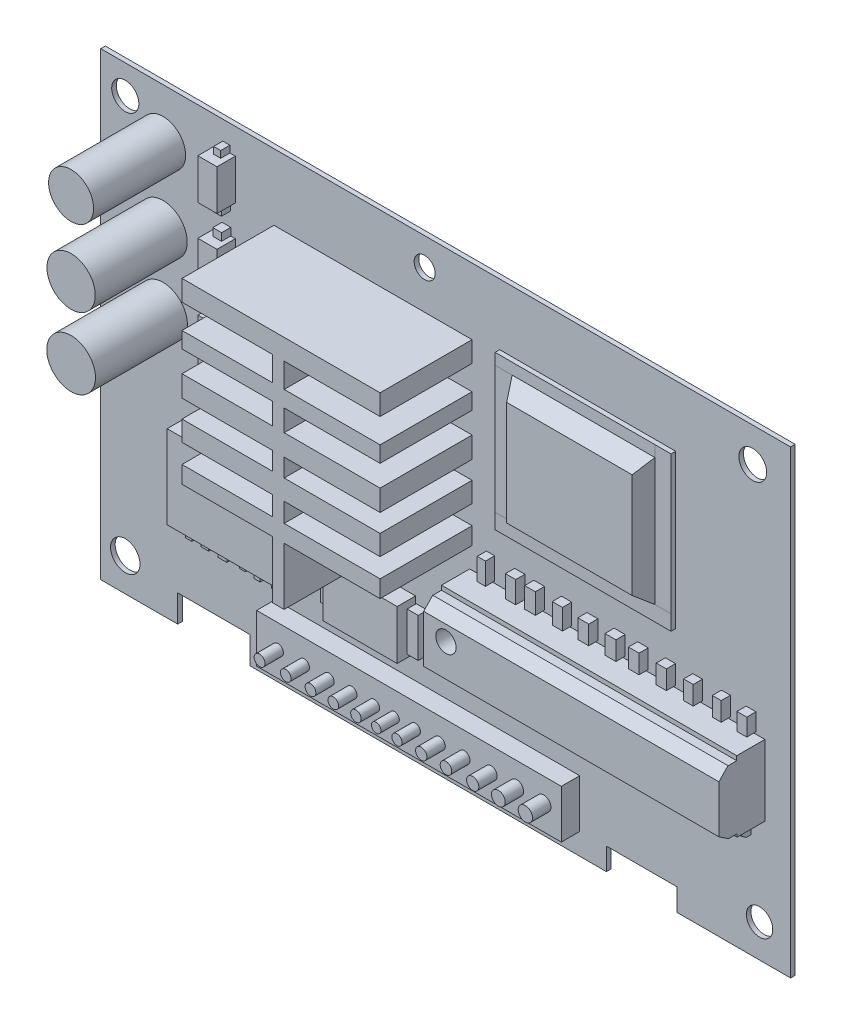
from build123d import *

# Parameters (mm, degrees)
SKETCH1_W            = 150
SKETCH1_H            = 100
BASE_FLANGE1_DEPTH   = 1
BOSS_EXTRUDE1_DEPTH  = 20
SKETCH7_W            = 38.251618342
SKETCH7_H            = 33.405476622
BOSS_EXTRUDE2_DEPTH  = 1
SKETCH20_R           = 4.893913718
SKETCH20_R_2         = 5.251573259
SKETCH20_R_3         = 5.291818848
BOSS_EXTRUDE6_DEPTH  = 20
SKETCH24_W           = 64.192317237
SKETCH24_H           = 15.400590588
BOSS_EXTRUDE8_DEPTH  = 10
CUT_EXTRUDE30_DEPTH  = 155.125892119
CUT_EXTRUDE31_DEPTH  = 70
SKETCH28_W           = 1.829521506
SKETCH28_H           = 1.981017468
CUT_EXTRUDE33_DEPTH  = 155.125892119
SKETCH29_W           = 1.913952811
SKETCH29_H           = 1.907943991
CUT_EXTRUDE34_DEPTH  = 70
SKETCH30_R           = 2.208258319
CUT_EXTRUDE35_DEPTH  = 4
SKETCH31_W           = 15.773922064
SKETCH31_H           = 7.980883473
CUT_EXTRUDE36_DEPTH  = 4
SKETCH32_W           = 15.316742759
SKETCH32_H           = 7.752912661
CUT_EXTRUDE37_DEPTH  = 4
SKETCH33_R           = 3.026227229
CUT_EXTRUDE38_DEPTH  = 4
SKETCH34_R           = 2.94966091
SKETCH34_R_2         = 3.19837787
SKETCH34_R_3         = 2.871285426
CUT_EXTRUDE39_DEPTH  = 4
SKETCH35_W           = 25.995297727
SKETCH35_H           = 18.101056575
BOSS_EXTRUDE9_DEPTH  = 4
SKETCH36_W           = 66.247990623
SKETCH36_H           = 10.503055181
BOSS_EXTRUDE10_DEPTH = 4
SKETCH37_R           = 1.181265196
SKETCH37_R_2         = 1.148680325
SKETCH37_R_3         = 1.160826502
SKETCH37_R_4         = 1.147015866
SKETCH37_R_5         = 1.033782863
SKETCH37_R_6         = 1.118734734
SKETCH37_R_7         = 1.234131395
SKETCH37_R_8         = 1.248812987
SKETCH37_R_9         = 1.327543916
SKETCH37_R_10        = 1.495383113
SKETCH37_R_11        = 1.557211208
BOSS_EXTRUDE11_DEPTH = 4
SKETCH38_R           = 2.284411124
CUT_EXTRUDE40_DEPTH  = 4
SKETCH41_W           = 1.375715726
SKETCH41_H           = 2.451416596
BOSS_EXTRUDE12_DEPTH = 2
SKETCH42_W           = 1.626401118
SKETCH42_H           = 2.461788857
BOSS_EXTRUDE13_DEPTH = 2
SKETCH43_W           = 1.958242371
SKETCH43_H           = 2.595832426
BOSS_EXTRUDE14_DEPTH = 2
SKETCH44_W           = 1.307161781
SKETCH44_H           = 3.440066665
BOSS_EXTRUDE15_DEPTH = 2
SKETCH45_W           = 1.379680109
SKETCH45_H           = 3.07138269
BOSS_EXTRUDE16_DEPTH = 2
SKETCH46_W           = 1.229332724
SKETCH46_H           = 3.115343909
BOSS_EXTRUDE17_DEPTH = 2
SKETCH47_W           = 1.427413705
SKETCH47_H           = 2.291843062
BOSS_EXTRUDE18_DEPTH = 2
SKETCH48_W           = 1.293247009
SKETCH48_H           = 2.149750627
BOSS_EXTRUDE19_DEPTH = 2
SKETCH49_W           = 1.181554162
SKETCH49_H           = 2.147356577
BOSS_EXTRUDE20_DEPTH = 2
SKETCH50_W           = 1.044464477
SKETCH50_H           = 2.065160328
BOSS_EXTRUDE21_DEPTH = 2
SKETCH51_W           = 1.029224977
SKETCH51_H           = 2.03555594
BOSS_EXTRUDE22_DEPTH = 2
SKETCH52_W           = 1.229200506
SKETCH52_H           = 1.921496808
BOSS_EXTRUDE24_DEPTH = 2
SKETCH53_W           = 1.112480255
SKETCH53_H           = 1.939294632
BOSS_EXTRUDE25_DEPTH = 2
SKETCH54_W           = 1.460651109
SKETCH54_H           = 1.9628929
BOSS_EXTRUDE26_DEPTH = 2
SKETCH55_W           = 2.862023797
SKETCH55_H           = 4.090480276
BOSS_EXTRUDE27_DEPTH = 2
SKETCH56_W           = 2.013853896
SKETCH56_H           = 4.191456529
SKETCH56_W_2         = 2.414065377
SKETCH56_W_3         = 2.03515958
SKETCH56_W_4         = 2.075413009
SKETCH56_W_5         = 2.49735471
SKETCH56_W_6         = 2.201159214
SKETCH56_H_2         = 4.020421204
SKETCH56_W_7         = 2.258671053
SKETCH56_W_8         = 2.935957611
SKETCH56_W_9         = 2.233644039
SKETCH56_W_10        = 2.248145216
BOSS_EXTRUDE28_DEPTH = 2
SKETCH57_W           = 2.145937785
SKETCH57_H           = 3.766112071
SKETCH57_W_2         = 1.928839135
SKETCH57_H_2         = 4.09164846
SKETCH57_W_3         = 2.091540081
SKETCH57_W_4         = 2.21160144
SKETCH57_W_5         = 2.308978198
SKETCH57_W_6         = 2.389169442
SKETCH57_W_7         = 2.368555189
SKETCH57_W_8         = 2.225421976
SKETCH57_H_3         = 4.453812364
SKETCH57_W_9         = 2.327276879
SKETCH57_W_10        = 2.233921941
SKETCH57_H_4         = 4.761879491
SKETCH57_W_11        = 1.792325782
SKETCH57_H_5         = 4.770248678
BOSS_EXTRUDE29_DEPTH = 2
SKETCH58_W           = 3.061349205
SKETCH58_H           = 1.907791472
SKETCH58_W_2         = 1.986025538
SKETCH58_H_2         = 2.155402711
SKETCH58_W_3         = 2.334649661
SKETCH58_W_4         = 2.149597386
SKETCH58_W_5         = 2.057874793
SKETCH58_W_6         = 2.49493272
SKETCH58_W_7         = 2.221617764
SKETCH58_H_3         = 1.916423675
SKETCH58_W_8         = 2.234745779
SKETCH58_H_4         = 2.236082286
SKETCH58_W_9         = 2.968185876
SKETCH58_H_5         = 2.280175952
SKETCH58_W_10        = 2.22983103
SKETCH58_W_11        = 2.240524801
BOSS_EXTRUDE30_DEPTH = 2
CUT_EXTRUDE42_DEPTH  = 70
CUT_EXTRUDE43_DEPTH  = 70
SKETCH62_W           = 16.149656918
SKETCH62_H           = 10.730261251
BOSS_EXTRUDE31_DEPTH = 4
SKETCH63_W           = 4.162884384
SKETCH63_H           = 8.812013171
SKETCH63_H_2         = 9.491073275
SKETCH63_H_3         = 9.653694527
BOSS_EXTRUDE32_DEPTH = 4
SKETCH64_W           = 1.82396348
SKETCH64_H           = 2.286507606
SKETCH64_W_2         = 1.584314373
SKETCH64_H_2         = 1.452145851
SKETCH64_W_3         = 1.542977073
SKETCH64_H_3         = 1.110525837
SKETCH64_W_4         = 1.911962543
SKETCH64_H_4         = 1.637025818
SKETCH64_W_5         = 1.724683831
SKETCH64_H_5         = 1.418797602
SKETCH64_W_6         = 1.547170171
SKETCH64_H_6         = 1.462342792
BOSS_EXTRUDE33_DEPTH = 2
SKETCH65_W           = 2.41426032
SKETCH65_H           = 8.495336877
SKETCH65_W_2         = 2.52605134
SKETCH65_H_2         = 8.055999216
BOSS_EXTRUDE34_DEPTH = 2
SKETCH8_W            = 30.996510459
SKETCH8_H            = 27.675141165
BOSS_EXTRUDE36_DEPTH = 3
CUT_EXTRUDE45_DEPTH  = 40
CUT_EXTRUDE46_DEPTH  = 40
CUT_EXTRUDE48_DEPTH  = 40
CUT_EXTRUDE50_DEPTH  = 40
SCALE1_SCALE         = 0.3


# Sheet-metal steps are written as plain solids
with BuildPart() as part:
    # Sketch1 → Base-Flange1 (new body)
    with BuildSketch(Plane.XY):
        Rectangle(SKETCH1_W, SKETCH1_H)
    extrude(amount=-BASE_FLANGE1_DEPTH)

    # Sketch6 → Boss-Extrude1 (add)
    with BuildSketch(Plane.XY):
        Polygon((-17.647750579, 31.094193667), (-17.647750579, 25.768885259), (-37.3337456, 25.768885259), (-37.3337456, 22.28272734), (-17.647750579, 22.28272734), (-17.647750579, 17.622101617), (-37.3337456, 17.622101617), (-37.3337456, 13.026910723), (-17.647750579, 13.026910723), (-17.647750579, 9.091734312), (-37.3337456, 9.091734312), (-37.3337456, 4.705010118), (-17.647750579, 4.705010118), (-17.647750579, 0.536354704), (-37.3337456, 0.536354704), (-37.3337456, -3.191619653), (-17.647750579, -3.191619653), (-17.647750579, -15.655678223), (-15.115535007, -15.655678223), (-15.115535007, -3.191619653), (5.742253828, -3.191619653), (5.742253828, 0.536354704), (-15.115535007, 0.536354704), (-15.115535007, 4.705010118), (5.742253828, 4.705010118), (5.742253828, 9.091734312), (-15.115535007, 9.091734312), (-15.115535007, 13.026910723), (5.742253828, 13.026910723), (5.742253828, 17.622101617), (-15.115535007, 17.622101617), (-15.115535007, 22.28272734), (5.742253828, 22.28272734), (5.742253828, 25.768885259), (-15.115535007, 25.768885259), (-15.115535007, 31.094193667), (5.742253828, 31.094193667), (5.742253828, 35.571913058), (-37.3337456, 35.571913058), (-37.3337456, 31.094193667), align=None)
    extrude(amount=BOSS_EXTRUDE1_DEPTH)

    # Sketch7 → Boss-Extrude2 (add)
    with BuildSketch(Plane.XY):
        with Locations((30.876301757, 19.988298592)):
            Rectangle(SKETCH7_W, SKETCH7_H)
    extrude(amount=BOSS_EXTRUDE2_DEPTH)

    # Sketch20 → Boss-Extrude6 (add)
    with BuildSketch(Plane.XY):
        with Locations((-61.445747498, 39.123272928)):
            Circle(SKETCH20_R)
        with Locations((-61.445747498, 22.944365114)):
            Circle(SKETCH20_R_2)
        with Locations((-61.445747498, 7.478393427)):
            Circle(SKETCH20_R_3)
    extrude(amount=BOSS_EXTRUDE6_DEPTH)

    # Sketch24 → Boss-Extrude8 (add)
    with BuildSketch(Plane.XY):
        with Locations((37.315719775, -15.564442532)):
            Rectangle(SKETCH24_W, SKETCH24_H)
    extrude(amount=BOSS_EXTRUDE8_DEPTH)

    # Sketch25 → Cut-Extrude30 (cut, through all)
    with BuildSketch(Plane(origin=(69.411878394, 0, 0), x_dir=(0, 0, -1), z_dir=(1, 0, 0))):
        Polygon((-6.95948185, -23.264737826), (-10, -21.210215597), (-10.383799283, -21.210215597), (-13.173179255, -25.338260702), align=None)
    extrude(amount=-CUT_EXTRUDE30_DEPTH, mode=Mode.SUBTRACT)

    # Sketch26 → Cut-Extrude31 (cut)
    with BuildSketch(Plane(origin=(69.411878394, 0, 0), x_dir=(0, 0, -1), z_dir=(1, 0, 0))):
        Polygon((-7.157587152, -7.864147238), (-10, -10.846715803), (-12.149574274, -7.378868006), align=None)
    extrude(amount=-CUT_EXTRUDE31_DEPTH, mode=Mode.SUBTRACT)

    # Sketch28 → Cut-Extrude33 (cut, through all)
    with BuildSketch(Plane(origin=(69.411878394, 0, 0), x_dir=(0, 0, -1), z_dir=(1, 0, 0))):
        with Locations((-6.95948185, -23.596243063)):
            Rectangle(SKETCH28_W, SKETCH28_H)
    extrude(amount=-CUT_EXTRUDE33_DEPTH, mode=Mode.SUBTRACT)

    # Sketch29 → Cut-Extrude34 (cut)
    with BuildSketch(Plane(origin=(69.411878394, 0, 0), x_dir=(0, 0, -1), z_dir=(1, 0, 0))):
        with Locations((-7.07856122, -7.864147238)):
            Rectangle(SKETCH29_W, SKETCH29_H)
    extrude(amount=-CUT_EXTRUDE34_DEPTH, mode=Mode.SUBTRACT)

    # Sketch30 → Cut-Extrude35 (cut)
    with BuildSketch(Plane.XY.offset(10)):
        with Locations((10.059798535, -14.15654171)):
            Circle(SKETCH30_R)
    extrude(amount=-CUT_EXTRUDE35_DEPTH, mode=Mode.SUBTRACT)

    # Sketch31 → Cut-Extrude36 (cut)
    with BuildSketch(Plane.XY):
        with Locations((-50.382765947, -48.096382801)):
            Rectangle(SKETCH31_W, SKETCH31_H)
    extrude(amount=-CUT_EXTRUDE36_DEPTH, mode=Mode.SUBTRACT)

    # Sketch32 → Cut-Extrude37 (cut)
    with BuildSketch(Plane.XY):
        with Locations((42.623404519, -49.055562996)):
            Rectangle(SKETCH32_W, SKETCH32_H)
    extrude(amount=-CUT_EXTRUDE37_DEPTH, mode=Mode.SUBTRACT)

    # Sketch33 → Cut-Extrude38 (cut)
    with BuildSketch(Plane.XY):
        with Locations((66.770748421, 42.592540068)):
            Circle(SKETCH33_R)
    extrude(amount=-CUT_EXTRUDE38_DEPTH, mode=Mode.SUBTRACT)

    # Sketch34 → Cut-Extrude39 (cut)
    with BuildSketch(Plane.XY):
        with Locations((-69.666143344, 43.767302707)):
            Circle(SKETCH34_R)
        with Locations((-69.666143344, -42.810509177)):
            Circle(SKETCH34_R_2)
        with Locations((68.245145494, -42.810509177)):
            Circle(SKETCH34_R_3)
    extrude(amount=-CUT_EXTRUDE39_DEPTH, mode=Mode.SUBTRACT)

    # Sketch35 → Boss-Extrude9 (add)
    with BuildSketch(Plane.XY):
        with Locations((-43.558798458, -19.388431916)):
            Rectangle(SKETCH35_W, SKETCH35_H)
    extrude(amount=BOSS_EXTRUDE9_DEPTH)

    # Sketch36 → Boss-Extrude10 (add)
    with BuildSketch(Plane.XY):
        with Locations((-3.980345024, -40.083616171)):
            Rectangle(SKETCH36_W, SKETCH36_H)
    extrude(amount=BOSS_EXTRUDE10_DEPTH)

    # Sketch37 → Boss-Extrude11 (add)
    with BuildSketch(Plane.XY.offset(4)):
        with Locations((-32.461773453, -39.922141762)):
            Circle(SKETCH37_R)
        with Locations((-26.768920114, -39.922141762)):
            Circle(SKETCH37_R_2)
        with Locations((-21.391562505, -39.922141762)):
            Circle(SKETCH37_R_3)
        with Locations((-16.432461651, -39.922141762)):
            Circle(SKETCH37_R_4)
        with Locations((-11.514578285, -39.922141762)):
            Circle(SKETCH37_R_4)
        with Locations((-7.111969395, -39.922141762)):
            Circle(SKETCH37_R_5)
        with Locations((-2.592262692, -39.922141762)):
            Circle(SKETCH37_R_6)
        with Locations((2.686057552, -39.922141762)):
            Circle(SKETCH37_R_7)
        with Locations((8.058652609, -39.922141762)):
            Circle(SKETCH37_R_8)
        with Locations((13.87803858, -39.922141762)):
            Circle(SKETCH37_R_9)
        with Locations((19.454436288, -39.922141762)):
            Circle(SKETCH37_R_10)
        with Locations((25.32464073, -39.922141762)):
            Circle(SKETCH37_R_11)
    extrude(amount=BOSS_EXTRUDE11_DEPTH)

    # Sketch38 → Cut-Extrude40 (cut)
    with BuildSketch(Plane.XY):
        with Locations((-4.570119234, 44.001544941)):
            Circle(SKETCH38_R)
    extrude(amount=-CUT_EXTRUDE40_DEPTH, mode=Mode.SUBTRACT)

    # Sketch41 → Boss-Extrude12 (add)
    with BuildSketch(Plane(origin=(0, -28.438960203, 0), x_dir=(-1, 0, 0), z_dir=(0, -1, 0))):
        with Locations((53.441447581, -1.225708298)):
            Rectangle(SKETCH41_W, SKETCH41_H)
    extrude(amount=BOSS_EXTRUDE12_DEPTH)

    # Sketch42 → Boss-Extrude13 (add)
    with BuildSketch(Plane(origin=(0, -28.438960203, 0), x_dir=(-1, 0, 0), z_dir=(0, -1, 0))):
        with Locations((49.882089405, -1.230894429)):
            Rectangle(SKETCH42_W, SKETCH42_H)
    extrude(amount=BOSS_EXTRUDE13_DEPTH)

    # Sketch43 → Boss-Extrude14 (add)
    with BuildSketch(Plane(origin=(0, -28.438960203, 0), x_dir=(-1, 0, 0), z_dir=(0, -1, 0))):
        with Locations((45.973423436, -1.297916213)):
            Rectangle(SKETCH43_W, SKETCH43_H)
    extrude(amount=BOSS_EXTRUDE14_DEPTH)

    # Sketch44 → Boss-Extrude15 (add)
    with BuildSketch(Plane(origin=(0, -28.438960203, 0), x_dir=(-1, 0, 0), z_dir=(0, -1, 0))):
        with Locations((41.827286179, -0.628457698)):
            Rectangle(SKETCH44_W, SKETCH44_H)
    extrude(amount=BOSS_EXTRUDE15_DEPTH)

    # Sketch45 → Boss-Extrude16 (add)
    with BuildSketch(Plane(origin=(0, -28.438960203, 0), x_dir=(-1, 0, 0), z_dir=(0, -1, 0))):
        with Locations((38.372398816, -1.129560262)):
            Rectangle(SKETCH45_W, SKETCH45_H)
    extrude(amount=BOSS_EXTRUDE16_DEPTH)

    # Sketch46 → Boss-Extrude17 (add)
    with BuildSketch(Plane(origin=(0, -28.438960203, 0), x_dir=(-1, 0, 0), z_dir=(0, -1, 0))):
        with Locations((34.656178331, -1.024237824)):
            Rectangle(SKETCH46_W, SKETCH46_H)
    extrude(amount=BOSS_EXTRUDE17_DEPTH)

    # Sketch47 → Boss-Extrude18 (add)
    with BuildSketch(Plane(origin=(0, -10.337903628, 0), x_dir=(1, 0, 0), z_dir=(0, 1, 0))):
        with Locations((-53.086628292, -1.145921531)):
            Rectangle(SKETCH47_W, SKETCH47_H)
    extrude(amount=BOSS_EXTRUDE18_DEPTH)

    # Sketch48 → Boss-Extrude19 (add)
    with BuildSketch(Plane(origin=(0, -10.337903628, 0), x_dir=(1, 0, 0), z_dir=(0, 1, 0))):
        with Locations((-49.855259062, -1.074875313)):
            Rectangle(SKETCH48_W, SKETCH48_H)
    extrude(amount=BOSS_EXTRUDE19_DEPTH)

    # Sketch49 → Boss-Extrude20 (add)
    with BuildSketch(Plane(origin=(0, -10.337903628, 0), x_dir=(1, 0, 0), z_dir=(0, 1, 0))):
        with Locations((-46.61660723, -1.073678289)):
            Rectangle(SKETCH49_W, SKETCH49_H)
    extrude(amount=BOSS_EXTRUDE20_DEPTH)

    # Sketch50 → Boss-Extrude21 (add)
    with BuildSketch(Plane(origin=(0, -10.337903628, 0), x_dir=(1, 0, 0), z_dir=(0, 1, 0))):
        with Locations((-43.679284061, -0.887375897)):
            Rectangle(SKETCH50_W, SKETCH50_H)
    extrude(amount=BOSS_EXTRUDE21_DEPTH)

    # Sketch51 → Boss-Extrude22 (add)
    with BuildSketch(Plane(origin=(0, -10.337903628, 0), x_dir=(1, 0, 0), z_dir=(0, 1, 0))):
        with Locations((-41.085941594, -0.915066637)):
            Rectangle(SKETCH51_W, SKETCH51_H)
    extrude(amount=BOSS_EXTRUDE22_DEPTH)

    # Sketch52 → Boss-Extrude24 (add)
    with BuildSketch(Plane.XY):
        with Locations((-38.491139911, -9.334604882)):
            Rectangle(SKETCH52_W, SKETCH52_H)
    extrude(amount=BOSS_EXTRUDE24_DEPTH)

    # Sketch53 → Boss-Extrude25 (add)
    with BuildSketch(Plane.XY):
        with Locations((-35.985401094, -9.471766755)):
            Rectangle(SKETCH53_W, SKETCH53_H)
    extrude(amount=BOSS_EXTRUDE25_DEPTH)

    # Sketch54 → Boss-Extrude26 (add)
    with BuildSketch(Plane.XY):
        with Locations((-32.796721328, -9.424908257)):
            Rectangle(SKETCH54_W, SKETCH54_H)
    extrude(amount=BOSS_EXTRUDE26_DEPTH)

    # Sketch55 → Boss-Extrude27 (add)
    with BuildSketch(Plane.XY):
        with Locations((9.4679968, -25.439262963)):
            Rectangle(SKETCH55_W, SKETCH55_H)
    extrude(amount=BOSS_EXTRUDE27_DEPTH)

    # Sketch56 → Boss-Extrude28 (add)
    with BuildSketch(Plane.XY):
        with Locations((15.930871519, -25.052037167)):
            Rectangle(SKETCH56_W, SKETCH56_H)
        with Locations((21.299661032, -25.052037167)):
            Rectangle(SKETCH56_W_2, SKETCH56_H)
        with Locations((26.145432754, -25.052037167)):
            Rectangle(SKETCH56_W_3, SKETCH56_H)
        with Locations((31.479211629, -25.052037167)):
            Rectangle(SKETCH56_W_4, SKETCH56_H)
        with Locations((36.292401806, -25.052037167)):
            Rectangle(SKETCH56_W_5, SKETCH56_H)
        with Locations((41.623450192, -25.329015551)):
            Rectangle(SKETCH56_W_6, SKETCH56_H_2)
        with Locations((47.47250203, -25.329015551)):
            Rectangle(SKETCH56_W_7, SKETCH56_H_2)
        with Locations((53.595229455, -25.329015551)):
            Rectangle(SKETCH56_W_8, SKETCH56_H_2)
        with Locations((59.694041926, -25.329015551)):
            Rectangle(SKETCH56_W_9, SKETCH56_H_2)
        with Locations((65.248987414, -25.329015551)):
            Rectangle(SKETCH56_W_10, SKETCH56_H_2)
    extrude(amount=BOSS_EXTRUDE28_DEPTH)

    # Sketch57 → Boss-Extrude29 (add)
    with BuildSketch(Plane.XY):
        with Locations((66.399242935, -5.520789868)):
            Rectangle(SKETCH57_W, SKETCH57_H)
        with Locations((60.943696913, -5.351478881)):
            Rectangle(SKETCH57_W_2, SKETCH57_H_2)
        with Locations((54.785557878, -5.351478881)):
            Rectangle(SKETCH57_W_3, SKETCH57_H_2)
        with Locations((48.883573918, -5.351478881)):
            Rectangle(SKETCH57_W_4, SKETCH57_H_2)
        with Locations((42.889723965, -5.351478881)):
            Rectangle(SKETCH57_W_5, SKETCH57_H_2)
        with Locations((37.826934409, -5.351478881)):
            Rectangle(SKETCH57_W_6, SKETCH57_H_2)
        with Locations((31.917946403, -5.351478881)):
            Rectangle(SKETCH57_W_7, SKETCH57_H_2)
        with Locations((26.295878957, -5.242532258)):
            Rectangle(SKETCH57_W_8, SKETCH57_H_3)
        with Locations((20.333553309, -5.242532258)):
            Rectangle(SKETCH57_W_9, SKETCH57_H_3)
        with Locations((16.106794882, -5.242532259)):
            Rectangle(SKETCH57_W_10, SKETCH57_H_4)
        with Locations((9.759089575, -5.04990077)):
            Rectangle(SKETCH57_W_11, SKETCH57_H_5)
    extrude(amount=BOSS_EXTRUDE29_DEPTH)

    # Sketch58 → Boss-Extrude30 (add)
    with BuildSketch(Plane.XY.offset(2)):
        with Locations((9.368334096, -24.287447968)):
            Rectangle(SKETCH58_W, SKETCH58_H)
        with Locations((15.935025298, -24.361561608)):
            Rectangle(SKETCH58_W_2, SKETCH58_H_2)
        with Locations((21.316704376, -24.361561608)):
            Rectangle(SKETCH58_W_3, SKETCH58_H_2)
        with Locations((26.088213851, -24.361561608)):
            Rectangle(SKETCH58_W_4, SKETCH58_H_2)
        with Locations((31.498824348, -24.361561608)):
            Rectangle(SKETCH58_W_5, SKETCH58_H_2)
        with Locations((36.293612801, -24.361561608)):
            Rectangle(SKETCH58_W_6, SKETCH58_H_2)
        with Locations((41.640508169, -24.32122182)):
            Rectangle(SKETCH58_W_7, SKETCH58_H_3)
        with Locations((47.484464667, -24.32122182)):
            Rectangle(SKETCH58_W_8, SKETCH58_H_4)
        with Locations((53.579115322, -24.504832935)):
            Rectangle(SKETCH58_W_9, SKETCH58_H_5)
        with Locations((59.69594843, -24.504832935)):
            Rectangle(SKETCH58_W_10, SKETCH58_H_5)
        with Locations((65.248383795, -24.504832935)):
            Rectangle(SKETCH58_W_11, SKETCH58_H_5)
    extrude(amount=BOSS_EXTRUDE30_DEPTH)

    # Sketch59 → Cut-Extrude42 (cut)
    with BuildSketch(Plane(origin=(66.368646195, 0, 0), x_dir=(0, 0, -1), z_dir=(1, 0, 0))):
        Polygon((-3.167794698, -25.644920911), (-4.471121941, -24.30317603), (-5.017719762, -26.218189345), align=None)
    extrude(amount=-CUT_EXTRUDE42_DEPTH, mode=Mode.SUBTRACT)

    # Sketch60 → Cut-Extrude43 (cut)
    with BuildSketch(Plane(origin=(66.373060022, 0, 0), x_dir=(0, 0, -1), z_dir=(1, 0, 0))):
        Polygon((-1, -27.339226153), (-2.440588327, -26.329263207), (-3.771198576, -27.550219069), (-3.51386615, -28.551200696), align=None)
    extrude(amount=-CUT_EXTRUDE43_DEPTH, mode=Mode.SUBTRACT)

    # Sketch62 → Boss-Extrude31 (add)
    with BuildSketch(Plane.XY):
        with Locations((-14.622272799, -24.190447402)):
            Rectangle(SKETCH62_W, SKETCH62_H)
    extrude(amount=BOSS_EXTRUDE31_DEPTH)

    # Sketch63 → Boss-Extrude32 (add)
    with BuildSketch(Plane.XY):
        with Locations((-47.807181002, 39.992576914)):
            Rectangle(SKETCH63_W, SKETCH63_H)
        with Locations((-47.807181002, 24.105594053)):
            Rectangle(SKETCH63_W, SKETCH63_H_2)
        with Locations((-47.807181002, 9.560017977)):
            Rectangle(SKETCH63_W, SKETCH63_H_3)
    extrude(amount=BOSS_EXTRUDE32_DEPTH)

    # Sketch64 → Boss-Extrude33 (add)
    with BuildSketch(Plane.XY):
        with Locations((-47.69029113, 2.967706586)):
            Rectangle(SKETCH64_W, SKETCH64_H)
        with Locations((-47.697382873, 15.112938167)):
            Rectangle(SKETCH64_W_2, SKETCH64_H_2)
        with Locations((-47.718051523, 18.170612557)):
            Rectangle(SKETCH64_W_3, SKETCH64_H_3)
        with Locations((-47.67958854, 29.669643599)):
            Rectangle(SKETCH64_W_4, SKETCH64_H_4)
        with Locations((-47.627198144, 34.258779813)):
            Rectangle(SKETCH64_W_5, SKETCH64_H_5)
        with Locations((-47.68892671, 45.129754895)):
            Rectangle(SKETCH64_W_6, SKETCH64_H_6)
    extrude(amount=BOSS_EXTRUDE33_DEPTH)

    # Sketch65 → Boss-Extrude34 (add)
    with BuildSketch(Plane.XY):
        with Locations((-5.186216329, -24.464382883)):
            Rectangle(SKETCH65_W, SKETCH65_H)
        with Locations((-23.922749004, -24.333427924)):
            Rectangle(SKETCH65_W_2, SKETCH65_H_2)
    extrude(amount=BOSS_EXTRUDE34_DEPTH)

    # Sketch8 → Boss-Extrude36 (add)
    with BuildSketch(Plane.XY.offset(1)):
        with Locations((31.012732639, 20.418844431)):
            Rectangle(SKETCH8_W, SKETCH8_H)
    extrude(amount=BOSS_EXTRUDE36_DEPTH)

    # Sketch72 → Cut-Extrude45 (cut)
    with BuildSketch(Plane(origin=(46.510987868, 0, 0), x_dir=(0, 0, -1), z_dir=(1, 0, 0))):
        Polygon((-4, 31.530886191), (-1, 34.256415013), (-4.945790408, 35.585741459), align=None)
    extrude(amount=-CUT_EXTRUDE45_DEPTH, mode=Mode.SUBTRACT)

    # Sketch73 → Cut-Extrude46 (cut)
    with BuildSketch(Plane(origin=(0, 6.581273848, 0), x_dir=(-1, 0, 0), z_dir=(0, -1, 0))):
        Polygon((-15.514477409, -1.110503972), (-17.778151425, -4.856238075), (-12.911077218, -5.38954298), align=None)
    extrude(amount=-CUT_EXTRUDE46_DEPTH, mode=Mode.SUBTRACT)

    # Sketch74 → Cut-Extrude48 (cut)
    with BuildSketch(Plane(origin=(0, 6.581273848, 0), x_dir=(-1, 0, 0), z_dir=(0, -1, 0))):
        Polygon((-46.510987868, -1), (-44.021403155, -4.779249321), (-47.858197998, -5.394597483), align=None)
    extrude(amount=-CUT_EXTRUDE48_DEPTH, mode=Mode.SUBTRACT)

    # Sketch76 → Cut-Extrude50 (cut)
    with BuildSketch(Plane(origin=(50.002110928, 0, 0), x_dir=(0, 0, -1), z_dir=(1, 0, 0))):
        Polygon((-1, 6.580298979), (-7.367230248, 11.297984555), (-7.498473278, 2.861320449), align=None)
    extrude(amount=-CUT_EXTRUDE50_DEPTH, mode=Mode.SUBTRACT)


with BuildPart() as part_1:
    # Scale1: scaled about (-4.650162937, 2.792949433, 5.123960062)
    add(part.part.scale(SCALE1_SCALE).moved(Location((-3.255114056, 1.955064603, 3.586772043))))


solid = part_1.part
